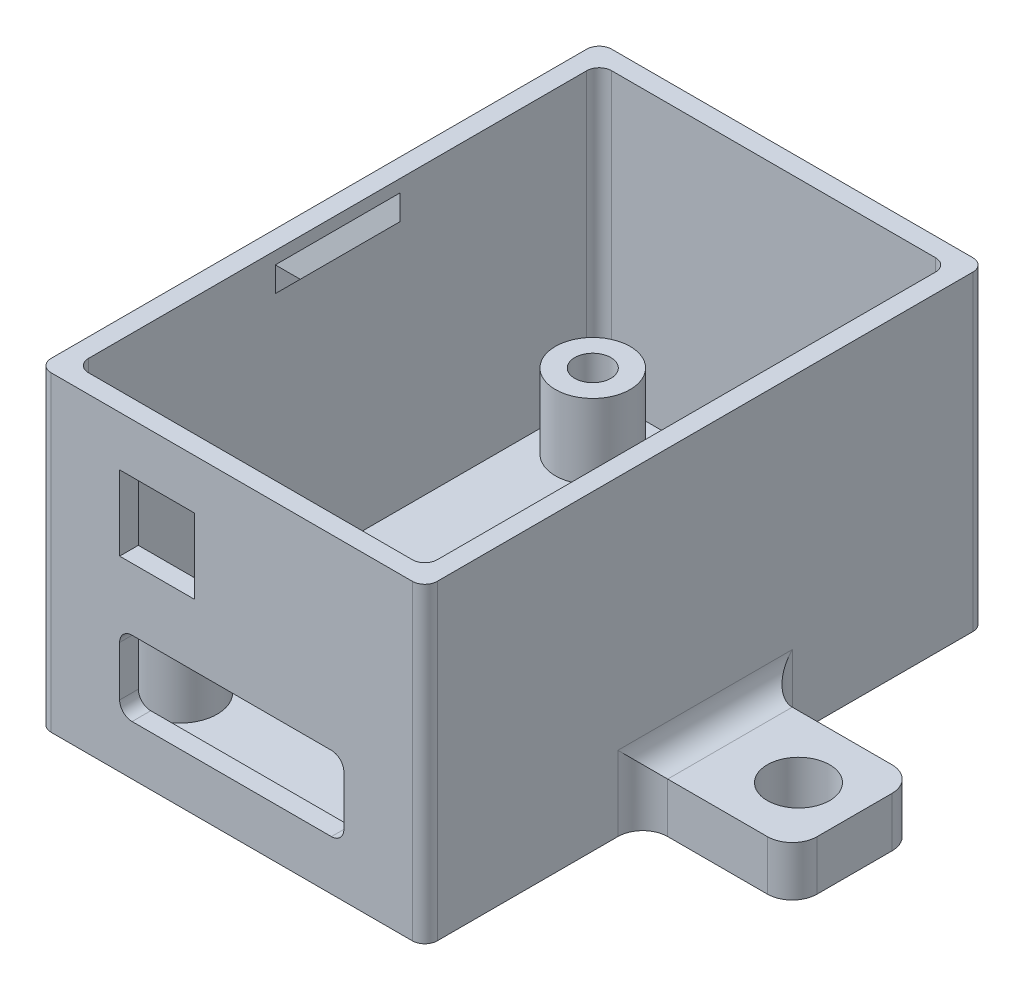
from build123d import *

# Parameters (mm, degrees)
SKETCH1_W                                         = 31
SKETCH1_H                                         = 45
BOSS_EXTRUDE1_DEPTH                               = 25
SKETCH2_W                                         = 28
SKETCH2_H                                         = 42
CUT_EXTRUDE1_DEPTH                                = 23
SKETCH3_R                                         = 3
BOSS_EXTRUDE5_DEPTH                               = 6
SKETCH4_W                                         = 18
SKETCH4_H                                         = 6
SKETCH4_W_2                                       = 6
CUT_EXTRUDE2_DEPTH                                = 1.5
CSK_FOR_M2_5_FLAT_HEAD_MACHINE_SCREW1_D           = 2.9
CSK_FOR_M2_5_FLAT_HEAD_MACHINE_SCREW1_CSINK_D     = 5.5
CSK_FOR_M2_5_FLAT_HEAD_MACHINE_SCREW1_CSINK_ANGLE = 90
FILLET2_R                                         = 1
SKETCH8_W                                         = 12
SKETCH8_H                                         = 10
BOSS_EXTRUDE6_DEPTH                               = 4
SKETCH9_R                                         = 2.5
CUT_EXTRUDE3_DEPTH                                = 4
FILLET3_R                                         = 2
FILLET4_R                                         = 2
SKETCH10_W                                        = 10
SKETCH10_H                                        = 2
BOSS_EXTRUDE7_DEPTH                               = 1
CHAMFER1_SIZE                                     = 1
SKETCH11_W                                        = 10
SKETCH11_H                                        = 2
BOSS_EXTRUDE8_DEPTH                               = 1
CHAMFER2_SIZE                                     = 1
FILLET5_R                                         = 2


with BuildPart() as part:
    # Sketch1 → Boss-Extrude1 (new body)
    with BuildSketch(Plane(origin=(0, 0, 0), x_dir=(1, 0, 0), z_dir=(0, 1, 0))):
        Rectangle(SKETCH1_W, SKETCH1_H)
    extrude(amount=BOSS_EXTRUDE1_DEPTH)

    # Sketch2 → Cut-Extrude1 (cut)
    with BuildSketch(Plane(origin=(0, 25, 0), x_dir=(1, 0, 0), z_dir=(0, 1, 0))):
        Rectangle(SKETCH2_W, SKETCH2_H)
    extrude(amount=-CUT_EXTRUDE1_DEPTH, mode=Mode.SUBTRACT)

    # Sketch3 → Boss-Extrude5 (add)
    with BuildSketch(Plane(origin=(0, 2, 0), x_dir=(1, 0, 0), z_dir=(0, 1, 0))):
        with Locations(Location((-10.090049644, 16.575, 0), (0, 0, 270))):
            Circle(SKETCH3_R)
        with Locations(Location((10.229950356, 16.575, 0), (0, 0, 270))):
            Circle(SKETCH3_R)
        with Locations(Location((10.229950356, -16.575, 0), (0, 0, 270))):
            Circle(SKETCH3_R)
        with Locations(Location((-10.090049644, -16.575, 0), (0, 0, 270))):
            Circle(SKETCH3_R)
    extrude(amount=BOSS_EXTRUDE5_DEPTH)

    # Sketch4 → Cut-Extrude2 (cut)
    with BuildSketch(Plane.XY.offset(22.5)):
        with Locations((0, 7)):
            Rectangle(SKETCH4_W, SKETCH4_H)
        with Locations((-6, 18)):
            Rectangle(SKETCH4_W_2, SKETCH4_H)
    extrude(amount=-CUT_EXTRUDE2_DEPTH, mode=Mode.SUBTRACT)

    # CSK for M2.5 Flat Head Machine Screw1 (through all)
    with Locations(Plane(origin=(0, 0, 0), x_dir=(-1, 0, 0), z_dir=(0, -1, 0))):
        with Locations((-10.229950356, -16.575), (10.090049644, -16.575), (10.090049644, 16.575), (-10.229950356, 16.575)):
            CounterSinkHole(CSK_FOR_M2_5_FLAT_HEAD_MACHINE_SCREW1_D / 2, CSK_FOR_M2_5_FLAT_HEAD_MACHINE_SCREW1_CSINK_D / 2, counter_sink_angle=CSK_FOR_M2_5_FLAT_HEAD_MACHINE_SCREW1_CSINK_ANGLE)

    # Fillet2
    fillet2_edges = [part.edges().sort_by_distance(p)[0] for p in [
        (14, 13.5, -21),
        (14, 13.5, 21),
        (-14, 13.5, 21),
        (-14, 13.5, -21),
        (-9, 4, 21.75),
        (-9, 10, 21.75),
        (9, 10, 21.75),
        (9, 4, 21.75),
        (15.5, 12.5, 22.5),
        (-15.5, 12.5, 22.5),
        (-15.5, 12.5, -22.5),
        (15.5, 12.5, -22.5),
    ]]
    fillet(fillet2_edges, radius=FILLET2_R)

    # Sketch8 → Boss-Extrude6 (add)
    with BuildSketch(Plane(origin=(0, 0, 0), x_dir=(1, 0, 0), z_dir=(0, 1, 0))):
        with Locations((21.5, 0)):
            Rectangle(SKETCH8_W, SKETCH8_H)
        with Locations((-21.5, 0)):
            Rectangle(SKETCH8_W, SKETCH8_H)
    extrude(amount=BOSS_EXTRUDE6_DEPTH)

    # Sketch9 → Cut-Extrude3 (cut)
    with BuildSketch(Plane(origin=(0, 4, 0), x_dir=(1, 0, 0), z_dir=(0, 1, 0))):
        with Locations(Location((23, 0, 0), (0, 0, 270))):
            Circle(SKETCH9_R)
        with Locations(Location((-23.5, 0, 0), (0, 0, 270))):
            Circle(SKETCH9_R)
    extrude(amount=-CUT_EXTRUDE3_DEPTH, mode=Mode.SUBTRACT)

    # Fillet3
    fillet3_edges = [part.edges().sort_by_distance(p)[0] for p in [
        (-15.5, 2, 5),
        (-15.5, 2, -5),
        (15.5, 2, -5),
        (15.5, 2, 5),
    ]]
    fillet(fillet3_edges, radius=FILLET3_R)

    # Fillet4
    fillet4_edges = [part.edges().sort_by_distance(p)[0] for p in [
        (15.5, 4, 0),
        (-15.5, 4, 0),
    ]]
    fillet(fillet4_edges, radius=FILLET4_R)

    # Sketch10 → Boss-Extrude7 (add)
    with BuildSketch(Plane(origin=(-14, 0, 0), x_dir=(0, 0, -1), z_dir=(1, 0, 0))):
        with Locations((0, 23)):
            Rectangle(SKETCH10_W, SKETCH10_H)
    extrude(amount=BOSS_EXTRUDE7_DEPTH)

    # Chamfer1
    chamfer1_edges = [part.edges().sort_by_distance(p)[0] for p in [
        (-13, 23, 5),
        (-13, 22, 0),
        (-13, 23, -5),
        (-13, 24, 0),
    ]]
    chamfer(chamfer1_edges, length=CHAMFER1_SIZE - 0.0001)  # a hair under: the kernel refuses the full size

    # Sketch11 → Boss-Extrude8 (add)
    with BuildSketch(Plane.ZY.offset(-14)):
        with Locations((0, 23)):
            Rectangle(SKETCH11_W, SKETCH11_H)
    extrude(amount=BOSS_EXTRUDE8_DEPTH)

    # Chamfer2
    chamfer2_edges = [part.edges().sort_by_distance(p)[0] for p in [
        (13, 23, 5),
        (13, 24, 0),
        (13, 22, 0),
        (13, 23, -5),
    ]]
    chamfer(chamfer2_edges, length=CHAMFER2_SIZE - 0.0001)  # a hair under: the kernel refuses the full size

    # Fillet5
    fillet5_edges = [part.edges().sort_by_distance(p)[0] for p in [
        (-27.5, 2, -5),
        (-27.5, 2, 5),
        (27.5, 2, 5),
        (27.5, 2, -5),
    ]]
    fillet(fillet5_edges, radius=FILLET5_R)


solid = part.part
